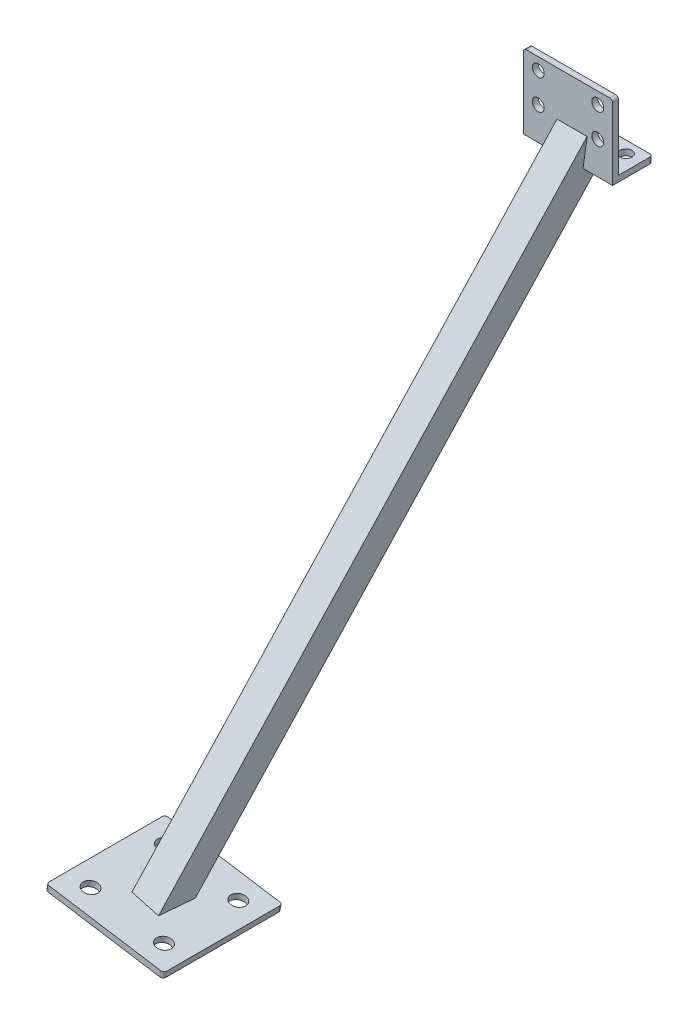
from build123d import *

# Parameters (mm, degrees)
BOSS_EXTRUDE1_DEPTH      = 60
BOSS_EXTRUDE2_DEPTH      = 500
BOSS_EXTRUDE2_DEPTH_BACK = 20
CUT_EXTRUDE1_DEPTH       = 60
BOSS_EXTRUDE3_DEPTH      = 4
SKETCH7_W                = 66.53307322741853
SKETCH7_H                = 100.00000000000006
CUT_EXTRUDE2_DEPTH       = 100
CUT_EXTRUDE3_REACH       = 450.752
SKETCH8_R                = 3.999999996290614
SKETCH8_R_2              = 3.999999996290612
SKETCH8_R_3              = 3.999999996290599
SKETCH8_R_4              = 3.9999999962905974
CUT_EXTRUDE4_REACH       = 450.752
SKETCH9_R                = 4.000000002943945
SKETCH9_R_2              = 4.000000002943925
CUT_EXTRUDE5_REACH       = 492.61
SKETCH10_R               = 5.000000000000006
SKETCH10_R_2             = 5.000000000000005
FILLET1_R                = 2
FILLET2_R                = 2


with BuildPart() as part:
    # Sketch1 → Boss-Extrude1 (new body)
    with BuildSketch(Plane(origin=(0, 0, 0), x_dir=(0, 0, -1), z_dir=(1, 0, 0))):
        Polygon((0, 0), (0, 50), (4, 50), (4.000000000000005, 4), (27, 4), (27, -2.82e-15), align=None)
    extrude(amount=BOSS_EXTRUDE1_DEPTH)

    # Sketch3 → Boss-Extrude2 (add, two sides: drawn at the far end of the back side and taken through both)
    with BuildSketch(Plane(origin=(0.7341522555726998, 4.014248509947268, -2.3176274578121165), x_dir=(0, -0.5000000000000011, -0.8660254037844382), z_dir=(-0.15643446504023129, -0.8553631939770857, 0.49384417029756994)).offset(-BOSS_EXTRUDE2_DEPTH_BACK)):
        Polygon((-10, 39.63065021785413), (10, 39.63065021785413), (10.000000000000002, 19.630650217854132), (-9.999999999999998, 19.630650217854132), align=None)
        Polygon((-9.000000000000002, 38.63065021785413), (9.000000000000002, 38.63065021785413), (9.000000000000005, 20.630650217854136), (-9, 20.630650217854136), align=None, mode=Mode.SUBTRACT)
    extrude(amount=BOSS_EXTRUDE2_DEPTH + BOSS_EXTRUDE2_DEPTH_BACK)

    # Sketch4 → Cut-Extrude1 (cut)
    with BuildSketch(Plane.ZY):
        Polygon((-4.000000000000005, 3.9999999999999947), (-4.000000000000005, 34.425897354185985), (-31.38403913433122, 4), align=None)
    extrude(amount=-CUT_EXTRUDE1_DEPTH, mode=Mode.SUBTRACT)

    # Sketch6 → Boss-Extrude3 (add)
    with BuildSketch(Plane(origin=(-56.756986796383245, -358.3495071731728, -6.035018838e-07), x_dir=(0.9876883403131397, -0.15643446682069626, -2.634536772853159e-10), z_dir=(0.15643446682069626, 0.9876883403131398, 1.66338103460011e-09))):
        Polygon((60.60249934727371, -165.5937403388422), (-19.397500652726297, -165.5937403388422), (-19.397500652726286, -245.5937403388422), (60.602499347273714, -245.5937403388422), align=None)
    extrude(amount=BOSS_EXTRUDE3_DEPTH)

    # Sketch7 → Cut-Extrude2 (cut)
    with BuildSketch(Plane(origin=(-56.75698679638309, -358.34950717317304, -6.0350189484e-07), x_dir=(0.9876883403131398, -0.15643446682069573, -2.6345368210226206e-10), z_dir=(-0.15643446682069573, -0.9876883403131398, -1.6633810650131218e-09))):
        with Locations((19.033988730271286, 218.77379525877697)):
            Rectangle(SKETCH7_W, SKETCH7_H)
    extrude(amount=CUT_EXTRUDE2_DEPTH, mode=Mode.SUBTRACT)

    # Sketch8 → Cut-Extrude3 (cut, up to next)
    with BuildSketch(Plane.XY, mode=Mode.PRIVATE) as cut_extrude3_sk1:
        with Locations((10.000000000000002, 21.999999999999982)):
            Circle(SKETCH8_R)
    cut_extrude3_tool1 = extrude(cut_extrude3_sk1.sketch, amount=-CUT_EXTRUDE3_REACH, mode=Mode.PRIVATE) & part.part
    # Sketch8 → Cut-Extrude3 (cut, up to next)
    with BuildSketch(Plane.XY, mode=Mode.PRIVATE) as cut_extrude3_sk2:
        with Locations((50.00000000000001, 21.999999999999975)):
            Circle(SKETCH8_R_2)
    cut_extrude3_tool2 = extrude(cut_extrude3_sk2.sketch, amount=-CUT_EXTRUDE3_REACH, mode=Mode.PRIVATE) & part.part
    # Sketch8 → Cut-Extrude3 (cut, up to next)
    with BuildSketch(Plane.XY, mode=Mode.PRIVATE) as cut_extrude3_sk3:
        with Locations((50.00000000000001, 41.999999999999964)):
            Circle(SKETCH8_R_3)
    cut_extrude3_tool3 = extrude(cut_extrude3_sk3.sketch, amount=-CUT_EXTRUDE3_REACH, mode=Mode.PRIVATE) & part.part
    # Sketch8 → Cut-Extrude3 (cut, up to next)
    with BuildSketch(Plane.XY, mode=Mode.PRIVATE) as cut_extrude3_sk4:
        with Locations((10.000000000000009, 41.99999999999998)):
            Circle(SKETCH8_R_4)
    cut_extrude3_tool4 = extrude(cut_extrude3_sk4.sketch, amount=-CUT_EXTRUDE3_REACH, mode=Mode.PRIVATE) & part.part
    add(cut_extrude3_tool1.solids().sort_by_distance((10, 22, 0))[0], mode=Mode.SUBTRACT)
    add(cut_extrude3_tool2.solids().sort_by_distance((50, 22, 0))[0], mode=Mode.SUBTRACT)
    add(cut_extrude3_tool3.solids().sort_by_distance((50, 42, 0))[0], mode=Mode.SUBTRACT)
    add(cut_extrude3_tool4.solids().sort_by_distance((10, 42, 0))[0], mode=Mode.SUBTRACT)

    # Sketch9 → Cut-Extrude4 (cut, up to next)
    with BuildSketch(Plane.XZ, mode=Mode.PRIVATE) as cut_extrude4_sk1:
        with Locations((50, -18.999999999999996)):
            Circle(SKETCH9_R)
    cut_extrude4_tool1 = extrude(cut_extrude4_sk1.sketch, amount=-CUT_EXTRUDE4_REACH, mode=Mode.PRIVATE) & part.part
    # Sketch9 → Cut-Extrude4 (cut, up to next)
    with BuildSketch(Plane.XZ, mode=Mode.PRIVATE) as cut_extrude4_sk2:
        with Locations((10.000000000000002, -18.999999999999996)):
            Circle(SKETCH9_R_2)
    cut_extrude4_tool2 = extrude(cut_extrude4_sk2.sketch, amount=-CUT_EXTRUDE4_REACH, mode=Mode.PRIVATE) & part.part
    add(cut_extrude4_tool1.solids().sort_by_distance((50, 0, -19))[0], mode=Mode.SUBTRACT)
    add(cut_extrude4_tool2.solids().sort_by_distance((10, 0, -19))[0], mode=Mode.SUBTRACT)

    # Sketch10 → Cut-Extrude5 (cut, up to next)
    with BuildSketch(Plane(origin=(-56.75698679638309, -358.34950717317304, -6.0350189484e-07), x_dir=(0.9876883403131398, -0.15643446682069573, -2.6345368210226206e-10), z_dir=(-0.15643446682069573, -0.9876883403131398, -1.6633810650131218e-09)), mode=Mode.PRIVATE) as cut_extrude5_sk1:
        with Locations((-4.397500652726306, 230.59374033884228)):
            Circle(SKETCH10_R)
    cut_extrude5_tool1 = extrude(cut_extrude5_sk1.sketch, amount=-CUT_EXTRUDE5_REACH, mode=Mode.PRIVATE) & part.part
    # Sketch10 → Cut-Extrude5 (cut, up to next)
    with BuildSketch(Plane(origin=(-56.75698679638309, -358.34950717317304, -6.0350189484e-07), x_dir=(0.9876883403131398, -0.15643446682069573, -2.6345368210226206e-10), z_dir=(-0.15643446682069573, -0.9876883403131398, -1.6633810650131218e-09)), mode=Mode.PRIVATE) as cut_extrude5_sk2:
        with Locations((45.6024993472737, 230.59374033884228)):
            Circle(SKETCH10_R_2)
    cut_extrude5_tool2 = extrude(cut_extrude5_sk2.sketch, amount=-CUT_EXTRUDE5_REACH, mode=Mode.PRIVATE) & part.part
    # Sketch10 → Cut-Extrude5 (cut, up to next)
    with BuildSketch(Plane(origin=(-56.75698679638309, -358.34950717317304, -6.0350189484e-07), x_dir=(0.9876883403131398, -0.15643446682069573, -2.6345368210226206e-10), z_dir=(-0.15643446682069573, -0.9876883403131398, -1.6633810650131218e-09)), mode=Mode.PRIVATE) as cut_extrude5_sk3:
        with Locations((45.60249934727421, 180.59374033884228)):
            Circle(SKETCH10_R_2)
    cut_extrude5_tool3 = extrude(cut_extrude5_sk3.sketch, amount=-CUT_EXTRUDE5_REACH, mode=Mode.PRIVATE) & part.part
    # Sketch10 → Cut-Extrude5 (cut, up to next)
    with BuildSketch(Plane(origin=(-56.75698679638309, -358.34950717317304, -6.0350189484e-07), x_dir=(0.9876883403131398, -0.15643446682069573, -2.6345368210226206e-10), z_dir=(-0.15643446682069573, -0.9876883403131398, -1.6633810650131218e-09)), mode=Mode.PRIVATE) as cut_extrude5_sk4:
        with Locations((-4.397500652725782, 180.59374033884228)):
            Circle(SKETCH10_R)
    cut_extrude5_tool4 = extrude(cut_extrude5_sk4.sketch, amount=-CUT_EXTRUDE5_REACH, mode=Mode.PRIVATE) & part.part
    add(cut_extrude5_tool1.solids().sort_by_distance((-61.100347, -357.661587, 230.59374))[0], mode=Mode.SUBTRACT)
    add(cut_extrude5_tool2.solids().sort_by_distance((-11.71593, -365.48331, 230.59374))[0], mode=Mode.SUBTRACT)
    add(cut_extrude5_tool3.solids().sort_by_distance((-11.71593, -365.48331, 180.59374))[0], mode=Mode.SUBTRACT)
    add(cut_extrude5_tool4.solids().sort_by_distance((-61.100347, -357.661587, 180.59374))[0], mode=Mode.SUBTRACT)

    # Fillet1
    fillet1_edges = [part.edges().sort_by_distance(p)[0] for p in [
        (-75.60280308865612, -353.3396932338914, 245.5937397437774),
        (-75.60280308865613, -353.33969309916216, 165.5937397437774),
        (3.4122641363950548, -365.85445044481787, 165.59373972270112),
        (3.412264136395062, -365.85445057954706, 245.59373972270112),
    ]]
    fillet(fillet1_edges, radius=FILLET1_R)

    # Fillet2
    fillet2_edges = [part.edges().sort_by_distance(p)[0] for p in [
        (60, 1.9999999999999987, -27),
        (0, 1.9999999999999987, -27),
        (60, 50, -2),
        (0, 50, -2),
    ]]
    fillet(fillet2_edges, radius=FILLET2_R)


solid = part.part
